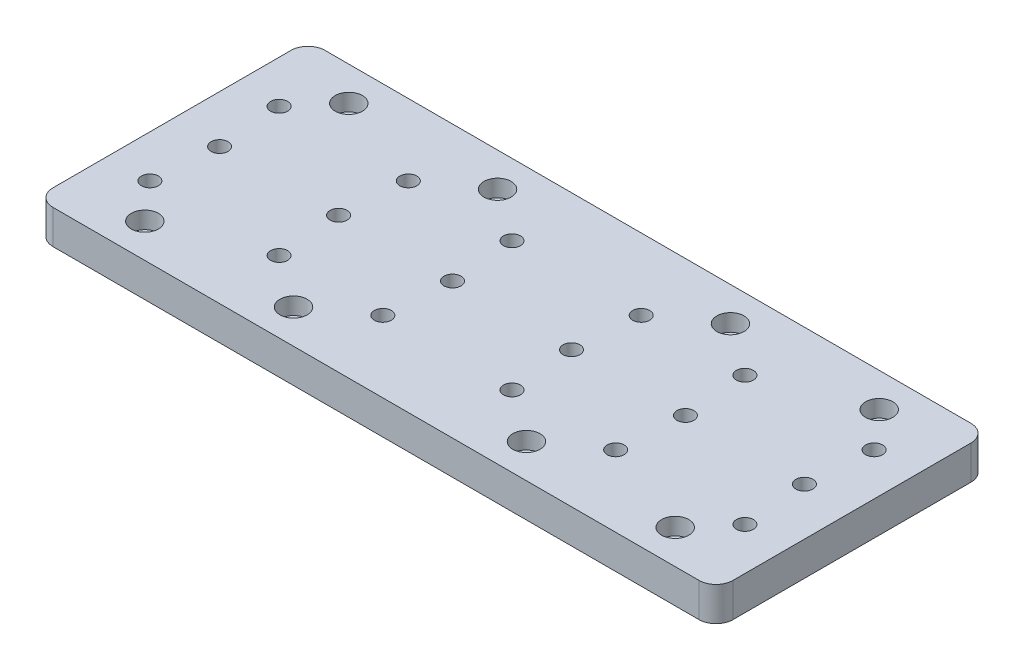
from build123d import *

# Parameters (mm, degrees)
SKETCH1_W               = 200
SKETCH1_H               = 80
BOSS_EXTRUDE1_DEPTH     = 10
FILLET1_R               = 5
OTHER_D10_OUTLINE_R     = 2.5
OTHER_D10_OUTLINE_R_2   = 2.25
OTHER_D10_DEPTH         = 10
OTHER_START             = 5
OTHER_D10_2_OUTLINE_R   = 4
OTHER_D10_2_OUTLINE_R_2 = 2.25
OTHER_D10_2_DEPTH       = 5


# Read off the part's stored shape, not the designer's step: the other step
with BuildPart() as part:
    # Sketch1 → Boss-Extrude1 (new body)
    with BuildSketch(Plane(origin=(0, 0, 0), x_dir=(1, 0, 0), z_dir=(0, 1, 0))):
        Rectangle(SKETCH1_W, SKETCH1_H)
    extrude(amount=BOSS_EXTRUDE1_DEPTH)

    # Fillet1
    fillet1_edges = [part.edges().sort_by_distance(p)[0] for p in [
        (-100, 5, -40),
        (100, 5, -40),
        (100, 5, 40),
        (-100, 5, 40),
    ]]
    fillet(fillet1_edges, radius=FILLET1_R)

    # Other D10 outline → Other D10 (cut)
    with BuildSketch(Plane(origin=(0, 0, 0), x_dir=(1, 0, 0), z_dir=(0, 1, 0))):
        with Locations((17.5, 0)):
            Circle(OTHER_D10_OUTLINE_R)
        with Locations((-17.5, 0)):
            Circle(OTHER_D10_OUTLINE_R)
        with Locations((-19, -19)):
            Circle(OTHER_D10_OUTLINE_R)
        with Locations((19, -19)):
            Circle(OTHER_D10_OUTLINE_R)
        with Locations((19, 19)):
            Circle(OTHER_D10_OUTLINE_R)
        with Locations((-19, 19)):
            Circle(OTHER_D10_OUTLINE_R)
        with Locations((-86, 0)):
            Circle(OTHER_D10_OUTLINE_R)
        with Locations((86, 0)):
            Circle(OTHER_D10_OUTLINE_R)
        with Locations((51, 0)):
            Circle(OTHER_D10_OUTLINE_R)
        with Locations((-51, 0)):
            Circle(OTHER_D10_OUTLINE_R)
        with Locations((49.5, -19)):
            Circle(OTHER_D10_OUTLINE_R)
        with Locations((49.5, 19)):
            Circle(OTHER_D10_OUTLINE_R)
        with Locations((-49.5, -19)):
            Circle(OTHER_D10_OUTLINE_R)
        with Locations((-49.5, 19)):
            Circle(OTHER_D10_OUTLINE_R)
        with Locations((87.5, -19)):
            Circle(OTHER_D10_OUTLINE_R)
        with Locations((87.5, 19)):
            Circle(OTHER_D10_OUTLINE_R)
        with Locations((-87.5, -19)):
            Circle(OTHER_D10_OUTLINE_R)
        with Locations((-87.5, 19)):
            Circle(OTHER_D10_OUTLINE_R)
        with Locations((-78, -30)):
            Circle(OTHER_D10_OUTLINE_R_2)
        with Locations((-78, 30)):
            Circle(OTHER_D10_OUTLINE_R_2)
        with Locations((78, -30)):
            Circle(OTHER_D10_OUTLINE_R_2)
        with Locations((78, 30)):
            Circle(OTHER_D10_OUTLINE_R_2)
        with Locations((-34.25, -30)):
            Circle(OTHER_D10_OUTLINE_R_2)
        with Locations((34.25, -30)):
            Circle(OTHER_D10_OUTLINE_R_2)
        with Locations((34.25, 30)):
            Circle(OTHER_D10_OUTLINE_R_2)
        with Locations((-34.25, 30)):
            Circle(OTHER_D10_OUTLINE_R_2)
    extrude(amount=OTHER_D10_DEPTH, mode=Mode.SUBTRACT)

    # Other D10 2 outline → Other D10 2 (cut)
    # profile 1 of 8: a face of its own
    with BuildSketch(Plane(origin=(0, 0, 0), x_dir=(1, 0, 0), z_dir=(0, 1, 0)).offset(OTHER_START)):
        with Locations((-78, -30)):
            Circle(OTHER_D10_2_OUTLINE_R)
        with Locations((-78, -30)):
            Circle(OTHER_D10_2_OUTLINE_R_2, mode=Mode.SUBTRACT)
    # profile 2 of 8: a face of its own
    with BuildSketch(Plane(origin=(0, 0, 0), x_dir=(1, 0, 0), z_dir=(0, 1, 0)).offset(OTHER_START)):
        with Locations((-78, 30)):
            Circle(OTHER_D10_2_OUTLINE_R)
        with Locations((-78, 30)):
            Circle(OTHER_D10_2_OUTLINE_R_2, mode=Mode.SUBTRACT)
    # profile 3 of 8: a face of its own
    with BuildSketch(Plane(origin=(0, 0, 0), x_dir=(1, 0, 0), z_dir=(0, 1, 0)).offset(OTHER_START)):
        with Locations((78, -30)):
            Circle(OTHER_D10_2_OUTLINE_R)
        with Locations((78, -30)):
            Circle(OTHER_D10_2_OUTLINE_R_2, mode=Mode.SUBTRACT)
    # profile 4 of 8: a face of its own
    with BuildSketch(Plane(origin=(0, 0, 0), x_dir=(1, 0, 0), z_dir=(0, 1, 0)).offset(OTHER_START)):
        with Locations((78, 30)):
            Circle(OTHER_D10_2_OUTLINE_R)
        with Locations((78, 30)):
            Circle(OTHER_D10_2_OUTLINE_R_2, mode=Mode.SUBTRACT)
    # profile 5 of 8: a face of its own
    with BuildSketch(Plane(origin=(0, 0, 0), x_dir=(1, 0, 0), z_dir=(0, 1, 0)).offset(OTHER_START)):
        with Locations((-34.25, -30)):
            Circle(OTHER_D10_2_OUTLINE_R)
        with Locations((-34.25, -30)):
            Circle(OTHER_D10_2_OUTLINE_R_2, mode=Mode.SUBTRACT)
    # profile 6 of 8: a face of its own
    with BuildSketch(Plane(origin=(0, 0, 0), x_dir=(1, 0, 0), z_dir=(0, 1, 0)).offset(OTHER_START)):
        with Locations((34.25, -30)):
            Circle(OTHER_D10_2_OUTLINE_R)
        with Locations((34.25, -30)):
            Circle(OTHER_D10_2_OUTLINE_R_2, mode=Mode.SUBTRACT)
    # profile 7 of 8: a face of its own
    with BuildSketch(Plane(origin=(0, 0, 0), x_dir=(1, 0, 0), z_dir=(0, 1, 0)).offset(OTHER_START)):
        with Locations((34.25, 30)):
            Circle(OTHER_D10_2_OUTLINE_R)
        with Locations((34.25, 30)):
            Circle(OTHER_D10_2_OUTLINE_R_2, mode=Mode.SUBTRACT)
    # profile 8 of 8: a face of its own
    with BuildSketch(Plane(origin=(0, 0, 0), x_dir=(1, 0, 0), z_dir=(0, 1, 0)).offset(OTHER_START)):
        with Locations((-34.25, 30)):
            Circle(OTHER_D10_2_OUTLINE_R)
        with Locations((-34.25, 30)):
            Circle(OTHER_D10_2_OUTLINE_R_2, mode=Mode.SUBTRACT)
    extrude(amount=OTHER_D10_2_DEPTH, mode=Mode.SUBTRACT)


solid = part.part
